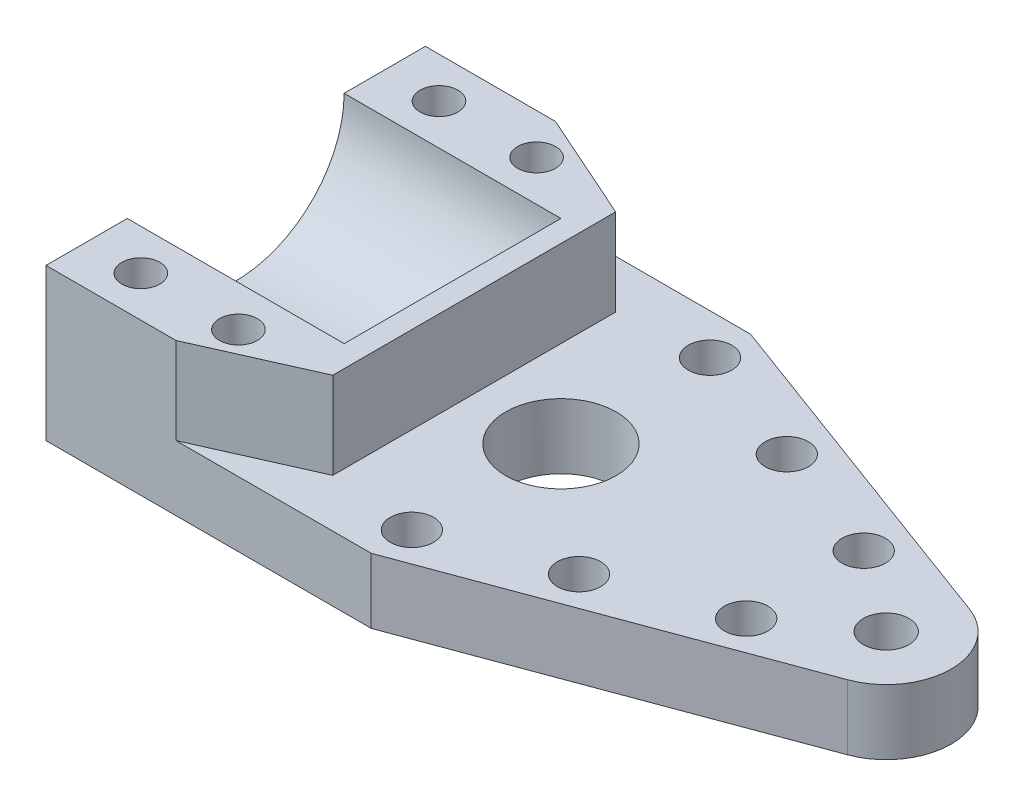
from build123d import *
from OCP.BRepFilletAPI import BRepFilletAPI_MakeChamfer

# Parameters (mm, degrees)
BOSS_EXTRUDE1_DEPTH      = 14
BOSS_EXTRUDE1_DEPTH_BACK = 14
SKETCH1_R                = 5.1
SKETCH1_R_2              = 2.1
SKETCH2_R                = 10
CUT_EXTRUDE1_DEPTH       = 20
CUT_EXTRUDE2_DEPTH       = 98
SKETCH4_R                = 2
SKETCH4_R_2              = 1.75
CUT_EXTRUDE3_DEPTH       = 98
CUT_EXTRUDE4_DEPTH       = 8
CHAMFER2_SIZE            = 10
CHAMFER2_SIZE2           = 4.452286853
SKETCH6_R                = 3.25
CUT_EXTRUDE5_DEPTH       = 1.5


with BuildPart() as part:
    # Sketch1 → Boss-Extrude1 (new, two sides: drawn at the far end of the back side and taken through both)
    with BuildSketch(Plane(origin=(0, 0, 0), x_dir=(1, 0, 0), z_dir=(0, 1, 0)).offset(-BOSS_EXTRUDE1_DEPTH_BACK)):
        with BuildLine():
            Line((-30, 17.5), (-30, -17.5))
            Line((-30, -17.5), (0, -17.5))
            Line((0, -17.5), (32.082434223, -5.627030097))
            ThreePointArc((32.082434223, -5.627030097), (36, 0), (32.082434223, 5.627030097))
            Line((32.082434223, 5.627030097), (0, 17.5))
            Line((0, 17.5), (-30, 17.5))
        make_face()
        Circle(SKETCH1_R, mode=Mode.SUBTRACT)
        with Locations((30, 0)):
            Circle(SKETCH1_R_2, mode=Mode.SUBTRACT)
    extrude(amount=BOSS_EXTRUDE1_DEPTH + BOSS_EXTRUDE1_DEPTH_BACK)

    # Sketch2 → Cut-Extrude1 (cut)
    with BuildSketch(Plane.ZY.offset(30)):
        Circle(SKETCH2_R)
    extrude(amount=-CUT_EXTRUDE1_DEPTH, mode=Mode.SUBTRACT)

    # Sketch3 → Cut-Extrude2 (cut)
    with BuildSketch(Plane.ZY.offset(30)):
        Polygon((-28.780571792, 0), (30.767977005, 0), (25.762660172, 25.983482973), (-26.204305774, 26.645951377), align=None)
    extrude(amount=-CUT_EXTRUDE2_DEPTH, mode=Mode.SUBTRACT)

    # Sketch4 → Cut-Extrude3 (cut)
    with BuildSketch(Plane(origin=(0, 0, 0), x_dir=(1, 0, 0), z_dir=(0, 1, 0))):
        with Locations((0, 13.75)):
            Circle(SKETCH4_R)
        with Locations((-25, 13.75)):
            Circle(SKETCH4_R_2)
        with Locations((-16, 13.75)):
            Circle(SKETCH4_R_2)
        with Locations((-16, -13.75)):
            Circle(SKETCH4_R_2)
        with Locations((-25, -13.75)):
            Circle(SKETCH4_R_2)
        with Locations((11.254060193, 9.585131554)):
            Circle(SKETCH4_R)
        with Locations((22.508120386, 5.420263108)):
            Circle(SKETCH4_R)
        with Locations((22.508120386, -5.420263108)):
            Circle(SKETCH4_R)
        with Locations((11.254060193, -9.585131554)):
            Circle(SKETCH4_R)
        with Locations((0, -13.75)):
            Circle(SKETCH4_R)
    extrude(amount=-CUT_EXTRUDE3_DEPTH, mode=Mode.SUBTRACT)

    # Sketch5 → Cut-Extrude4 (cut)
    with BuildSketch(Plane(origin=(0, 0, 0), x_dir=(1, 0, 0), z_dir=(0, 1, 0))):
        Polygon((-8, 24.0496753), (-8, -23.963165676), (49.955299995, -27.912565933), (56.964446833, 12.889933884), align=None)
    extrude(amount=-CUT_EXTRUDE4_DEPTH, mode=Mode.SUBTRACT)

    # Chamfer2: one chamfer whose edges measure the first distance from different faces: ONE call of the kernel's chamfer builder (chamfer() names one face for all edges)
    chamfer2_edges_1 = [part.edges().sort_by_distance(p)[0] for p in [
        (-8, -4, 17.5),
    ]]
    chamfer2_side_1 = [part.faces().sort_by_distance(p)[0] for p in [
        (-16.97752809, -7.539325843, 17.5),
    ]]
    chamfer2_edges_2 = [part.edges().sort_by_distance(p)[0] for p in [
        (-8, -4, -17.5),
    ]]
    chamfer2_side_2 = [part.faces().sort_by_distance(p)[0] for p in [
        (-16.97752809, -7.539325843, -17.5),
    ]]
    chamfer2 = BRepFilletAPI_MakeChamfer(part.part.solid().wrapped)
    for e in chamfer2_edges_1:
        chamfer2.Add(CHAMFER2_SIZE, CHAMFER2_SIZE2, e.wrapped, chamfer2_side_1[0].wrapped)  # the first distance lies on this face
    for e in chamfer2_edges_2:
        chamfer2.Add(CHAMFER2_SIZE, CHAMFER2_SIZE2, e.wrapped, chamfer2_side_2[0].wrapped)  # the first distance lies on this face
    add(Compound.cast(chamfer2.Shape()), mode=Mode.REPLACE)

    # Sketch6 → Cut-Extrude5 (cut)
    with BuildSketch(Plane.XZ.offset(14)):
        with Locations((-25, 13.75)):
            Circle(SKETCH6_R)
        with Locations((-16, 13.75)):
            Circle(SKETCH6_R)
        with Locations((-25, -13.75)):
            Circle(SKETCH6_R)
        with Locations((-16, -13.75)):
            Circle(SKETCH6_R)
    extrude(amount=-CUT_EXTRUDE5_DEPTH, mode=Mode.SUBTRACT)


solid = part.part
